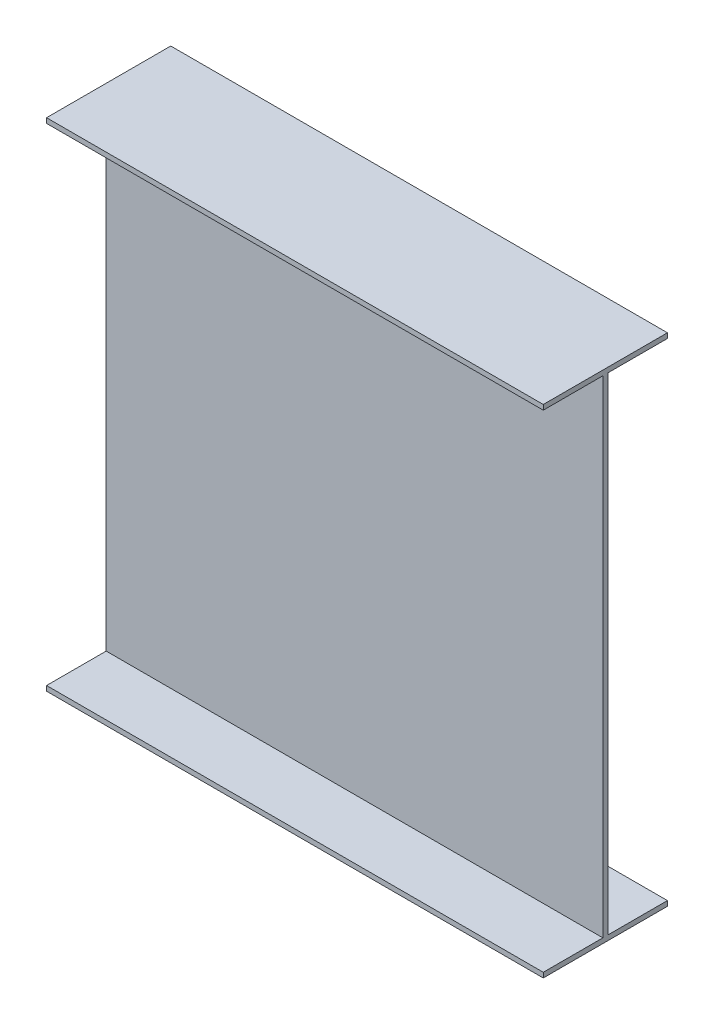
from build123d import *

# Parameters (mm, degrees)
BOSS_EXTRUDE1_DEPTH = 1000


with BuildPart() as part:
    # Sketch1 → Boss-Extrude1 (new body)
    with BuildSketch(Plane(origin=(0, 0, 0), x_dir=(0, 0, -1), z_dir=(1, 0, 0))):
        Polygon((-4.58433585, -956.116259735), (115.41566415, -956.116259735), (115.41566415, -966.116259735), (-134.58433585, -966.116259735), (-134.58433585, -956.116259735), (-14.58433585, -956.116259735), (-14.58433585, 23.883740265), (-134.58433585, 23.883740265), (-134.58433585, 33.883740265), (115.41566415, 33.883740265), (115.41566415, 23.883740265), (-4.58433585, 23.883740265), align=None)
    extrude(amount=BOSS_EXTRUDE1_DEPTH)


solid = part.part
